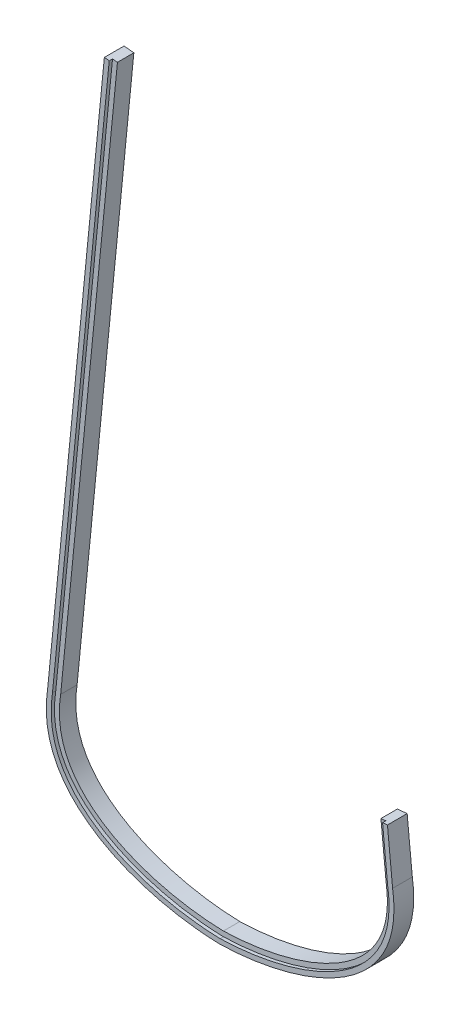
from build123d import *

# Parameters (mm, degrees)
BOSS_EXTRUDE1_DEPTH = 19.05
CUT_EXTRUDE1_START  = -3.175
CUT_EXTRUDE1_DEPTH  = 3.175


# Read off the part's stored shape, not the designer's step: Cut-Extrude1
with BuildPart() as part:
    # Sketch1 → Boss-Extrude1 (new body)
    with BuildSketch(Plane.XY):
        with BuildLine():
            Line((157.234081882, 128.980548454), (152.224173193, 179.795336584))
            Line((152.224173193, 179.795336584), (161.70321507, 180.729890008))
            Line((161.70321507, 180.729890008), (166.6875, 130.175))
            add(Edge.make_bspline(
                [(0, 0), (73.666580622, 1.740675992), (181.188092361, 36.200835609), (166.6875, 130.175)],
                knots=[0, 0, 0, 0, 1, 1, 1, 1], degree=3))
            add(Edge.make_bspline(
                [(0, 0), (-73.666580622, 1.740675992), (-181.188092361, 36.200835609), (-166.6875, 130.175)],
                knots=[0, 0, 0, 0, 1, 1, 1, 1], degree=3))
            Line((-166.6875, 130.175), (-111.860365766, 686.278790089))
            Line((-111.860365766, 686.278790089), (-102.381323889, 685.344236665))
            Line((-102.381323889, 685.344236665), (-157.234081882, 128.980548454))
            add(Edge.make_bspline(
                [(0, 9.52776174), (-1.117611602, 9.555193192), (-3.340472897, 9.624755056), (-7.880039481, 9.827207732), (-13.652210416, 10.198958437), (-20.725459036, 10.840441372), (-30.303235723, 11.962316267), (-42.47749757, 13.875858033), (-57.165232888, 17.02314898), (-71.689613059, 21.050850851), (-90.515854195, 27.626537064), (-112.436111514, 38.157452487), (-130.643933928, 51.803557723), (-142.189146149, 64.564536934), (-149.192253507, 75.075537554), (-153.541361304, 84.674022673), (-156.058613173, 92.923629982), (-157.442658539, 99.418206789), (-158.29640922, 106.242287005), (-158.540175044, 112.221426054), (-158.437150466, 117.190167219), (-158.20642164, 121.010360535), (-157.881730698, 124.277278241), (-157.584058118, 126.601085874), (-157.415798733, 127.781927866), (-157.316566229, 128.446705395), (-157.261207353, 128.804756083), (-157.234081882, 128.980548454)],
                knots=[0.001057036, 0.001057036, 0.001057036, 0.001057036, 0.016679825, 0.032302613, 0.063548191, 0.094793768, 0.126039346, 0.1885305, 0.251021655, 0.31351281, 0.376003965, 0.500986274, 0.625968584, 0.688459739, 0.750950893, 0.813442048, 0.844687626, 0.875933203, 0.90717878, 0.938424358, 0.954047147, 0.969669935, 0.985292724, 0.993104118, 0.997009815, 0.998962664, 1.000915513, 1.000915513, 1.000915513, 1.000915513], degree=3))
            add(Edge.make_bspline(
                [(157.234081882, 128.980548454), (157.261207353, 128.804756083), (157.316566229, 128.446705395), (157.415798733, 127.781927866), (157.584058118, 126.601085874), (157.881730698, 124.277278241), (158.20642164, 121.010360535), (158.437150466, 117.190167219), (158.540175044, 112.221426054), (158.29640922, 106.242287005), (157.442658539, 99.418206789), (156.058613173, 92.923629982), (153.541361304, 84.674022673), (149.192253507, 75.075537554), (142.189146149, 64.564536934), (130.643933928, 51.803557723), (112.436111514, 38.157452487), (90.515854195, 27.626537064), (71.689613059, 21.050850851), (57.165232888, 17.02314898), (42.47749757, 13.875858033), (30.303235723, 11.962316267), (20.725459036, 10.840441372), (13.652210416, 10.198958437), (7.880039481, 9.827207732), (3.340472897, 9.624755056), (1.117611602, 9.555193192), (0, 9.52776174)],
                knots=[0.001057036, 0.001057036, 0.001057036, 0.001057036, 0.003009885, 0.004962733, 0.00886843, 0.016679825, 0.032302613, 0.047925402, 0.063548191, 0.094793768, 0.126039346, 0.157284923, 0.1885305, 0.251021655, 0.31351281, 0.376003965, 0.500986274, 0.625968584, 0.688459739, 0.750950893, 0.813442048, 0.875933203, 0.90717878, 0.938424358, 0.969669935, 0.985292724, 1.000915513, 1.000915513, 1.000915513, 1.000915513], degree=3))
        make_face()
    extrude(amount=BOSS_EXTRUDE1_DEPTH)

    # Cut-Extrude1 outline → Cut-Extrude1 (cut)
    with BuildSketch(Plane.XY.offset(19.05).offset(CUT_EXTRUDE1_START)):
        with BuildLine():
            Line((-107.13348355, 685.812759448), (-161.973395498, 129.579366829))
            add(Edge.make_bspline(
                [(-161.973395498, 129.579366829), (-162.00171525, 129.395834674), (-162.028495082, 129.221667618), (-162.081541528, 128.869683844), (-162.159761136, 128.342436218), (-162.332851825, 127.117281326), (-162.641575692, 124.687275119), (-162.842770083, 122.639027203), (-163.16267738, 118.588121623), (-163.265984358, 115.948323615), (-163.262423556, 108.206156668), (-162.842404671, 103.28119599), (-161.248767489, 93.87057237), (-160.075199693, 89.384607046), (-157.045094148, 80.81595139), (-155.188366146, 76.733021658), (-150.853165213, 68.941465452), (-148.374445898, 65.232835538), (-142.854480948, 58.172008914), (-139.813114246, 54.819957421), (-129.940113205, 45.284353516), (-122.357367523, 39.621644841), (-105.759630554, 29.639229241), (-96.746229237, 25.320471564), (-77.904058281, 17.968013466), (-68.075890669, 14.934086027), (-48.230630184, 10.070216513), (-38.213566045, 8.240058869), (-18.618837768, 5.689359978), (-9.040867048, 4.96882986), (0, 4.751150948)],
                knots=[0, 0, 0, 0, 0.001953125, 0.001953125, 0.00390625, 0.0078125, 0.015625, 0.03125, 0.03125, 0.0625, 0.0625, 0.125, 0.125, 0.1875, 0.1875, 0.25, 0.25, 0.3125, 0.3125, 0.375, 0.375, 0.5, 0.5, 0.625, 0.625, 0.75, 0.75, 0.875, 0.875, 1, 1, 1, 1], degree=3))
            add(Edge.make_bspline(
                [(0, 4.751150948), (9.040867048, 4.96882986), (18.618837768, 5.689359978), (38.213566045, 8.240058869), (48.230630184, 10.070216513), (68.075890669, 14.934086027), (77.904058281, 17.968013466), (96.746229237, 25.320471564), (105.759630554, 29.639229241), (122.357367523, 39.621644841), (129.940113205, 45.284353516), (139.813114246, 54.819957421), (142.854480948, 58.172008914), (148.374445898, 65.232835538), (150.853165213, 68.941465452), (155.188366146, 76.733021658), (157.045094148, 80.81595139), (160.075199693, 89.384607046), (161.248767489, 93.87057237), (162.842404671, 103.28119599), (163.262423556, 108.206156668), (163.265984358, 115.948323615), (163.16267738, 118.588121623), (162.842770083, 122.639027203), (162.708640489, 124.004525814), (162.465162127, 126.075850353), (162.332851825, 127.117281326), (162.159761136, 128.342436218), (162.081541528, 128.869683844), (162.028495082, 129.221667618), (162.00171525, 129.395834674), (161.973395498, 129.579366829)],
                knots=[0, 0, 0, 0, 0.125, 0.125, 0.25, 0.25, 0.375, 0.375, 0.5, 0.5, 0.625, 0.625, 0.6875, 0.6875, 0.75, 0.75, 0.8125, 0.8125, 0.875, 0.875, 0.9375, 0.9375, 0.96875, 0.96875, 0.984375, 0.984375, 0.9921875, 0.99609375, 0.998046875, 0.998046875, 1, 1, 1, 1], degree=3))
            Line((161.973395498, 129.579366829), (156.976332854, 180.263859367))
            Line((156.976332854, 180.263859367), (152.224173193, 179.795336584))
            Line((152.224173193, 179.795336584), (157.234081882, 128.980548454))
            add(Edge.make_bspline(
                [(157.234081882, 128.980548454), (157.261207353, 128.804756083), (157.316566229, 128.446705395), (157.415798733, 127.781927866), (157.584058118, 126.601085874), (157.881730698, 124.277278241), (158.20642164, 121.010360535), (158.437150466, 117.190167219), (158.540175044, 112.221426054), (158.29640922, 106.242287005), (157.442658539, 99.418206789), (156.058613173, 92.923629982), (153.541361304, 84.674022673), (149.192253507, 75.075537554), (142.189146149, 64.564536934), (130.643933928, 51.803557723), (112.436111514, 38.157452487), (90.515854195, 27.626537064), (71.689613059, 21.050850851), (57.165232888, 17.02314898), (42.47749757, 13.875858033), (30.303235723, 11.962316267), (20.725459036, 10.840441372), (13.652210416, 10.198958437), (7.880039481, 9.827207732), (3.340472897, 9.624755056), (1.117611602, 9.555193192), (0, 9.52776174)],
                knots=[0.001057036, 0.001057036, 0.001057036, 0.001057036, 0.003009885, 0.004962733, 0.00886843, 0.016679825, 0.032302613, 0.047925402, 0.063548191, 0.094793768, 0.126039346, 0.157284923, 0.1885305, 0.251021655, 0.31351281, 0.376003965, 0.500986274, 0.625968584, 0.688459739, 0.750950893, 0.813442048, 0.875933203, 0.90717878, 0.938424358, 0.969669935, 0.985292724, 1.000915513, 1.000915513, 1.000915513, 1.000915513], degree=3))
            add(Edge.make_bspline(
                [(0, 9.52776174), (-1.117611602, 9.555193192), (-3.340472897, 9.624755056), (-7.880039481, 9.827207732), (-13.652210416, 10.198958437), (-20.725459036, 10.840441372), (-30.303235723, 11.962316267), (-42.47749757, 13.875858033), (-57.165232888, 17.02314898), (-71.689613059, 21.050850851), (-90.515854195, 27.626537064), (-112.436111514, 38.157452487), (-130.643933928, 51.803557723), (-142.189146149, 64.564536934), (-149.192253507, 75.075537554), (-153.541361304, 84.674022673), (-156.058613173, 92.923629982), (-157.442658539, 99.418206789), (-158.29640922, 106.242287005), (-158.540175044, 112.221426054), (-158.437150466, 117.190167219), (-158.20642164, 121.010360535), (-157.881730698, 124.277278241), (-157.584058118, 126.601085874), (-157.415798733, 127.781927866), (-157.316566229, 128.446705395), (-157.261207353, 128.804756083), (-157.234081882, 128.980548454)],
                knots=[0.001057036, 0.001057036, 0.001057036, 0.001057036, 0.016679825, 0.032302613, 0.063548191, 0.094793768, 0.126039346, 0.1885305, 0.251021655, 0.31351281, 0.376003965, 0.500986274, 0.625968584, 0.688459739, 0.750950893, 0.813442048, 0.844687626, 0.875933203, 0.90717878, 0.938424358, 0.954047147, 0.969669935, 0.985292724, 0.993104118, 0.997009815, 0.998962664, 1.000915513, 1.000915513, 1.000915513, 1.000915513], degree=3))
            Line((-157.234081882, 128.980548454), (-102.381323889, 685.344236665))
            Line((-102.381323889, 685.344236665), (-107.13348355, 685.812759448))
        make_face()
    extrude(amount=CUT_EXTRUDE1_DEPTH, mode=Mode.SUBTRACT)


solid = part.part
